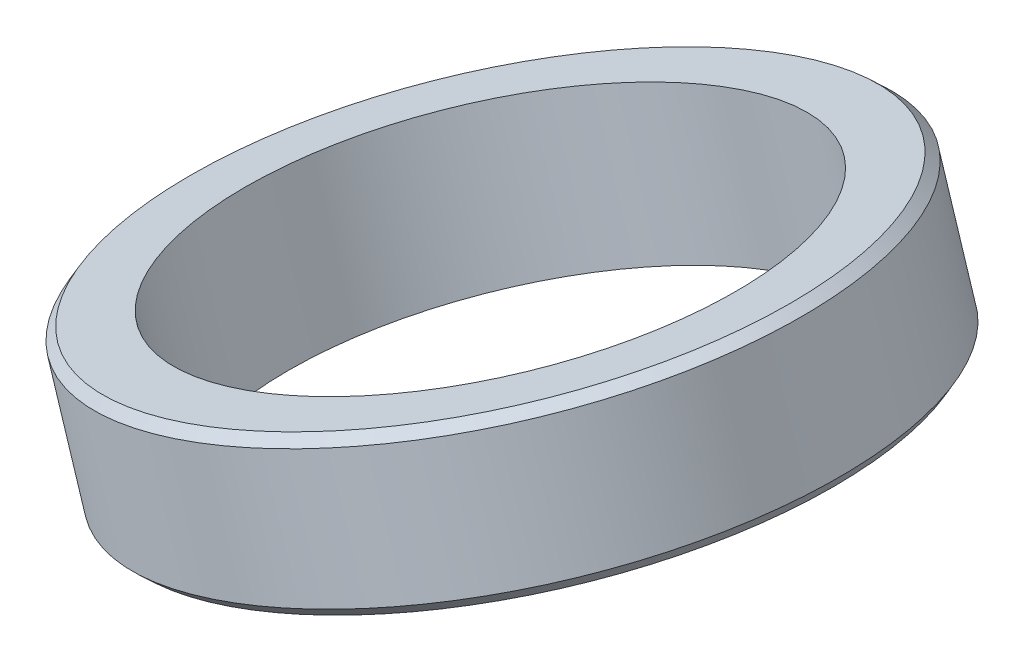
from build123d import *


with BuildPart() as part:
    # Sk_Contratuerca → Contratuerca (revolve)
    with BuildSketch(Plane.XY):
        Polygon((370.413114254, 564.580213901), (373.464999937, 565.542499606), (374.092214216, 565.215999609), (376.197214195, 558.539999677), (375.870714198, 557.912785398), (372.818828515, 556.950499693), align=None)
    revolve(axis=Axis((355.271428694, 565.048571039, 0), (0.3007142826457713, -0.9537142759825079, 0)))


solid = part.part
